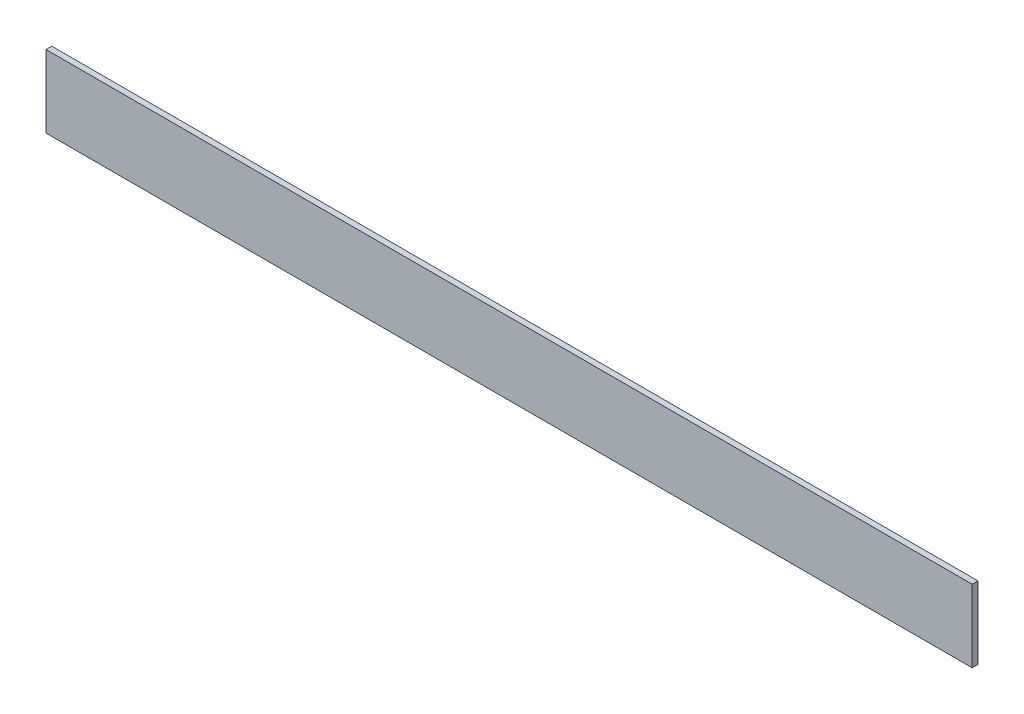
from build123d import *

# Parameters (mm, degrees)
EXTRUDE_1_DEPTH     = 320
SKETCH_2_W          = 23
SKETCH_2_H          = 23
CUT_EXTRUDE_1_DEPTH = 322.94720064


with BuildPart() as part:
    # Эскиз1 → Вытянуть-Тонкостенный1 (new body)
    with BuildSketch(Plane(origin=(0, 0, 0), x_dir=(0, 0, -1), z_dir=(1, 0, 0))):
        Polygon((0, 25), (0, 0), (25, 0), (25, 2), (2, 2), (2, 25), align=None)
    extrude(amount=EXTRUDE_1_DEPTH)

    # Эскиз2 → Вырез-Вытянуть1 (cut, through all)
    with BuildSketch(Plane.XZ):
        with Locations((308.5, -13.5)):
            Rectangle(SKETCH_2_W, SKETCH_2_H)
    extrude(amount=-CUT_EXTRUDE_1_DEPTH, mode=Mode.SUBTRACT)


solid = part.part
